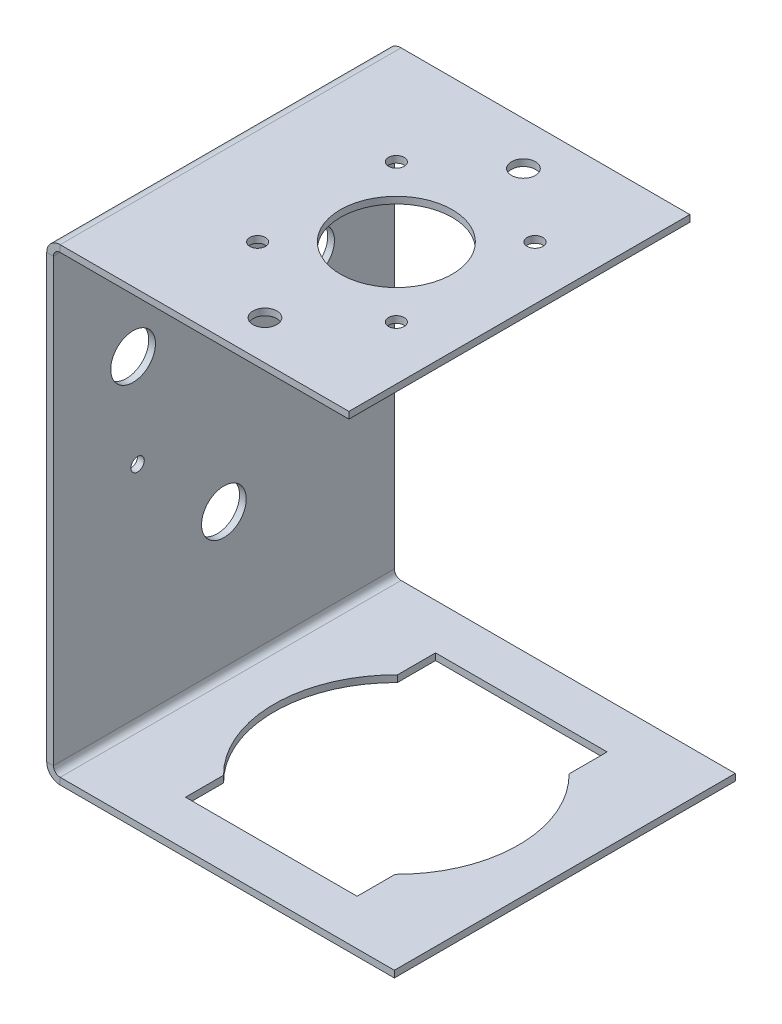
from build123d import *

# Parameters (mm, degrees)
SKETCH63_W                     = 76.2
SKETCH63_H                     = 101.6
BRACKET_INTERFACE_DEPTH        = 1.5
SKETCH57_R                     = 2.8
SKETCH57_R_2                   = 1.5
SKETCH57_R_3                   = 5
CUT_EXTRUDE7_DEPTH             = 2.54
STEPPER_FLANGE_STRIP_W         = 9
STEPPER_FLANGE_STRIP_H         = 1.5
STEPPER_FLANGE_STRIP_CUT_DEPTH = 76.2
STEPPER_FLANGE_DEPTH           = 76.2
BARREL_FLANGE_STRIP_W          = 9
BARREL_FLANGE_STRIP_H          = 1.5
BARREL_FLANGE_STRIP_CUT_DEPTH  = 76.2
BARREL_FLANGE_DEPTH            = 76.2
SKETCH75_R                     = 1.75
SKETCH75_R_2                   = 12.5
NEMA_17_PATTERN_DEPTH          = 2.54
SKETCH82_R                     = 27.305
CUT_EXTRUDE8_DEPTH             = 5
CUT_EXTRUDE17_REACH            = 136.904
CUT_EXTRUDE18_REACH            = 136.904
SKETCH145_R                    = 2.667


# Sheet-metal steps are written as plain solids
with BuildPart() as part:
    # Sketch63 → Bracket_Interface (new body)
    with BuildSketch(Plane(origin=(0, 0, 0), x_dir=(0, 0, -1), z_dir=(1, 0, 0))):
        Rectangle(SKETCH63_W, SKETCH63_H)
    extrude(amount=-BRACKET_INTERFACE_DEPTH)

    # Sketch57 → Cut-Extrude7 (cut)
    # profile 1 of 7: a face of its own
    with BuildSketch(Plane(origin=(0, 0, 0), x_dir=(0, 0, -1), z_dir=(1, 0, 0))):
        with Locations((9.203487694, 8.439536918)):
            Circle(SKETCH57_R)
        with Locations((9.203487694, 8.439536918)):
            Circle(SKETCH57_R_2, mode=Mode.SUBTRACT)
    # profile 2 of 7: a face of its own
    with BuildSketch(Plane(origin=(0, 0, 0), x_dir=(0, 0, -1), z_dir=(1, 0, 0))):
        with Locations((23.203487694, 8.439536918)):
            Circle(SKETCH57_R)
        with Locations((23.203487694, 8.439536918)):
            Circle(SKETCH57_R_2, mode=Mode.SUBTRACT)
    # profile 3 of 7: a face of its own
    with BuildSketch(Plane(origin=(0, 0, 0), x_dir=(0, 0, -1), z_dir=(1, 0, 0))):
        with Locations((0, -19.210463082)):
            Circle(SKETCH57_R_3)
    # profile 4 of 7: a face of its own
    with BuildSketch(Plane(origin=(0, 0, 0), x_dir=(0, 0, -1), z_dir=(1, 0, 0))):
        with Locations((-19.296512306, -0.360463082)):
            Circle(SKETCH57_R_2)
    # profile 5 of 7: a face of its own
    with BuildSketch(Plane(origin=(0, 0, 0), x_dir=(0, 0, -1), z_dir=(1, 0, 0))):
        with Locations((-1.796512306, 18.539536918)):
            Circle(SKETCH57_R_2)
    # profile 6 of 7: a face of its own
    with BuildSketch(Plane(origin=(0, 0, 0), x_dir=(0, 0, -1), z_dir=(1, 0, 0))):
        with Locations((19.703487694, 20.989536918)):
            Circle(SKETCH57_R_3)
    # profile 7 of 7: a face of its own
    with BuildSketch(Plane(origin=(0, 0, 0), x_dir=(0, 0, -1), z_dir=(1, 0, 0))):
        with Locations((-20.296512306, 20.989536918)):
            Circle(SKETCH57_R_3)
    extrude(amount=-CUT_EXTRUDE7_DEPTH, mode=Mode.SUBTRACT)


with BuildPart() as body_2:
    # of the pieces the cut leaves, the one that is kept (cut_extrude7_keep)
    add(part.part.solids().sort_by_distance((0, 50.8, 38.1))[0])

    # Stepper_Flange strip (across the edge) → Stepper_Flange strip cut (cut)
    with BuildSketch(Plane(origin=(0, 50.8, -38.1), x_dir=(0, -1, 0), z_dir=(0, 0, 1))):
        with Locations((-3, -0.75)):
            Rectangle(STEPPER_FLANGE_STRIP_W, STEPPER_FLANGE_STRIP_H)
    extrude(amount=STEPPER_FLANGE_STRIP_CUT_DEPTH, mode=Mode.SUBTRACT)

    # Stepper_Flange section (across the edge) → Stepper_Flange (add)
    with BuildSketch(Plane(origin=(0, 50.8, -38.1), x_dir=(0, -1, 0), z_dir=(0, 0, 1))):
        with BuildLine():
            Line((-1.5, 1.5), (-1.5, 66.04))
            Line((-1.5, 66.04), (0, 66.04))
            Line((0, 66.04), (0, 1.5))
            ThreePointArc((0, 1.5), (0.439339828, 0.439339828), (1.5, 0))
            Line((1.5, 0), (1.5, -1.5))
            ThreePointArc((1.5, -1.5), (-0.621320344, -0.621320344), (-1.5, 1.5))
        make_face()
    extrude(amount=STEPPER_FLANGE_DEPTH)

    # Barrel_Flange strip (across the edge) → Barrel_Flange strip cut (cut)
    with BuildSketch(Plane(origin=(0, -50.8, 38.1), x_dir=(0, 1, 0), z_dir=(0, 0, -1))):
        with Locations((-3, -0.75)):
            Rectangle(BARREL_FLANGE_STRIP_W, BARREL_FLANGE_STRIP_H)
    extrude(amount=BARREL_FLANGE_STRIP_CUT_DEPTH, mode=Mode.SUBTRACT)

    # Barrel_Flange section (across the edge) → Barrel_Flange (add)
    with BuildSketch(Plane(origin=(0, -50.8, 38.1), x_dir=(0, 1, 0), z_dir=(0, 0, -1))):
        with BuildLine():
            Line((-1.5, 1.5), (-1.5, 76.2))
            Line((-1.5, 76.2), (0, 76.2))
            Line((0, 76.2), (0, 1.5))
            ThreePointArc((0, 1.5), (0.439339828, 0.439339828), (1.5, 0))
            Line((1.5, 0), (1.5, -1.5))
            ThreePointArc((1.5, -1.5), (-0.621320344, -0.621320344), (-1.5, 1.5))
        make_face()
    extrude(amount=BARREL_FLANGE_DEPTH)

    # Sketch75 → NEMA_17_Pattern (cut)
    with BuildSketch(Plane(origin=(0, 52.3, 0), x_dir=(1, 0, 0), z_dir=(0, 1, 0))):
        with Locations(Location((23.04, 15.5, 0), (0, 0, 180))):
            Circle(SKETCH75_R)
        with Locations(Location((54.04, 15.5, 0), (0, 0, 180))):
            Circle(SKETCH75_R)
        with Locations(Location((54.04, -15.5, 0), (0, 0, 180))):
            Circle(SKETCH75_R)
        with Locations(Location((23.04, -15.5, 0), (0, 0, 180))):
            Circle(SKETCH75_R)
        with Locations(Location((38.54, 0, 0), (0, 0, 180))):
            Circle(SKETCH75_R_2)
    extrude(amount=-NEMA_17_PATTERN_DEPTH, mode=Mode.SUBTRACT)

    # Sketch82 → Cut-Extrude8 (cut)
    with BuildSketch(Plane(origin=(0, -50.8, 0), x_dir=(1, 0, 0), z_dir=(0, 1, 0))):
        with Locations(Location((38.54, 0, 0), (0, 0, 180))):
            Circle(SKETCH82_R)
    extrude(amount=-CUT_EXTRUDE8_DEPTH, mode=Mode.SUBTRACT)

    # Sketch142 → Cut-Extrude17 (cut, up to next)
    with BuildSketch(Plane.XZ.offset(52.3), mode=Mode.PRIVATE) as cut_extrude17_sk1:
        with BuildLine():
            Line((19.363, 19.437224493), (19.363, 27.94))
            Line((19.363, 27.94), (57.717, 27.94))
            Line((57.717, 27.94), (57.717, 19.437224493))
            ThreePointArc((57.717, 19.437224493), (38.54, 27.305), (19.363, 19.437224493))
        make_face()
    cut_extrude17_tool1 = extrude(cut_extrude17_sk1.sketch, amount=-CUT_EXTRUDE17_REACH, mode=Mode.PRIVATE) & body_2.part
    cut_extrude17 = cut_extrude17_tool1.solids().sort_by_distance((38.54, -52.3, 27.697852))[0]
    add(cut_extrude17, mode=Mode.SUBTRACT)

    # Mirror1: Cut-Extrude17 across plane
    add(cut_extrude17.mirror(Plane.XY), mode=Mode.SUBTRACT)

    # Sketch145 → Cut-Extrude18 (cut, up to next)
    with BuildSketch(Plane(origin=(0, 52.3, 0), x_dir=(1, 0, 0), z_dir=(0, 1, 0)), mode=Mode.PRIVATE) as cut_extrude18_sk1:
        with Locations(Location((38.54, 28.410128662, 0), (0, 0, 180))):
            Circle(SKETCH145_R)
    cut_extrude18_tool1 = extrude(cut_extrude18_sk1.sketch, amount=-CUT_EXTRUDE18_REACH, mode=Mode.PRIVATE) & body_2.part
    # Sketch145 → Cut-Extrude18 (cut, up to next)
    with BuildSketch(Plane(origin=(0, 52.3, 0), x_dir=(1, 0, 0), z_dir=(0, 1, 0)), mode=Mode.PRIVATE) as cut_extrude18_sk2:
        with Locations(Location((38.54, -29.364200147, 0), (0, 0, 180))):
            Circle(SKETCH145_R)
    cut_extrude18_tool2 = extrude(cut_extrude18_sk2.sketch, amount=-CUT_EXTRUDE18_REACH, mode=Mode.PRIVATE) & body_2.part
    add(cut_extrude18_tool1.solids().sort_by_distance((38.54, 52.3, -28.410129))[0], mode=Mode.SUBTRACT)
    add(cut_extrude18_tool2.solids().sort_by_distance((38.54, 52.3, 29.3642))[0], mode=Mode.SUBTRACT)


solid = body_2.part
